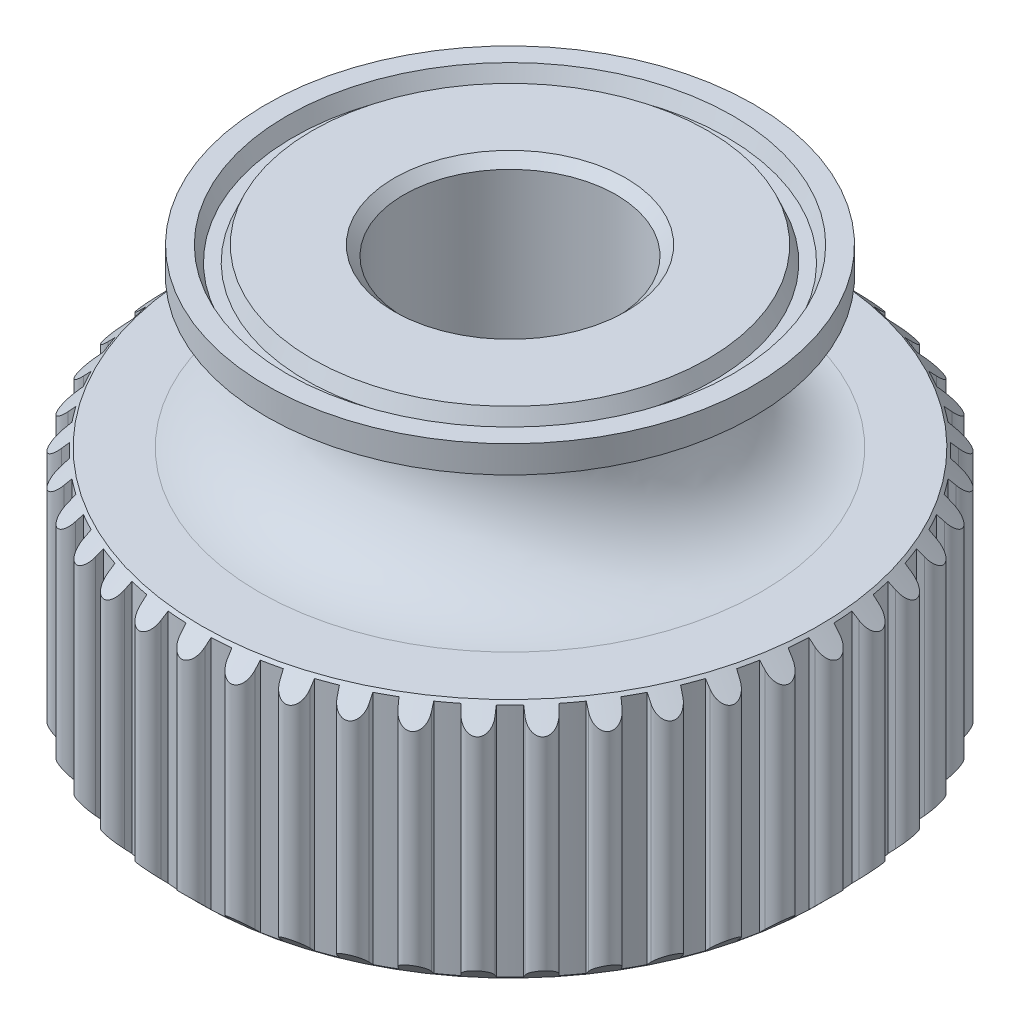
from build123d import *

# Parameters (mm, degrees)
SKETCH1_R           = 25.3
BOSS_EXTRUDE1_DEPTH = 20
SWEEP1_PITCH        = 5
SKETCH10_R          = 32.3
BOSS_EXTRUDE2_DEPTH = 25
SKETCH12_R          = 27.5
CUT_EXTRUDE2_DEPTH  = 2
CUT_EXTRUDE3_DEPTH  = 1
SKETCH16_R          = 11
CUT_EXTRUDE4_DEPTH  = 53.07283378
FILLET2_R           = 1.143
FILLET3_R           = 10
CHAMFER2_SIZE       = 1
BOSS_EXTRUDE3_DEPTH = 25
CIRPATTERN1_COUNT   = 44


with BuildPart() as part:
    # Sketch1 → Boss-Extrude1 (new body)
    with BuildSketch(Plane(origin=(0, 0, 0), x_dir=(1, 0, 0), z_dir=(0, 1, 0))):
        with Locations(Location((0, 0, 0), (0, 0, 270))):
            Circle(SKETCH1_R)
    extrude(amount=BOSS_EXTRUDE1_DEPTH)

    # Sweep1: the profile of Sketch4 screwed along a right-hand helix of 3.5 turns, 12 arcs to a turn; built about Z, then put on its axis
    sweep1_z = Axis((0, 0, 0), (0, 0, 1))
    sweep1_corners = [(25.3, 0.050300798, -1.599209126), (26, 0.050300798, -1.599209126), (27.6, 0, 0), (26, -0.050300798, 1.599209126), (25.4, -0.050300798, 1.599209126), (24.8, -0.050300798, 1.599209126), (24.8, 0.050300798, -1.599209126)]
    with BuildLine(mode=Mode.PRIVATE) as sweep1_profile:
        Line(sweep1_corners[0], sweep1_corners[1])
        Line(sweep1_corners[3], sweep1_corners[4])
        Line(sweep1_corners[4], sweep1_corners[5])
        Line(sweep1_corners[5], sweep1_corners[6])
        Line(sweep1_corners[6], sweep1_corners[0])
        ThreePointArc((26, 0.050300798, -1.599209126), (27.13137085, 0.035568035, -1.130811618), (27.6, 0, 0))
        ThreePointArc((27.6, 0, 0), (27.13137085, -0.035568035, 1.130811618), (26, -0.050300798, 1.599209126))
    sweep1_cap = Face(sweep1_profile.wire())
    sweep1_arcs = [((26, 0.050300798, -1.599209126), (27.6, 0.050300798, -1.599209126), (27.6, 0, 0), (1, 0.7071067811865476, 1)), ((27.6, 0, 0), (27.6, -0.050300798, 1.599209126), (26, -0.050300798, 1.599209126), (1, 0.7071067811865476, 1))]  # start, shoulder, end, weights
    sweep1_turn_angles = [0, 15, 30, 45, 60, 75, 90, 105, 120, 135, 150, 165, 180, 195, 210, 225, 240, 255, 270, 285, 300, 315, 330, 345, 360]
    sweep1_turn_weights = [1, 0.9659258262890683, 1, 0.9659258262890683, 1, 0.9659258262890683, 1, 0.9659258262890683, 1, 0.9659258262890683, 1, 0.9659258262890683, 1, 0.9659258262890683, 1, 0.9659258262890683, 1, 0.9659258262890683, 1, 0.9659258262890683, 1, 0.9659258262890683, 1, 0.9659258262890683, 1]
    sweep1_turn_rails = [Edge.make_bspline([Vector(p[0], p[1], 0).rotate(sweep1_z, sweep1_turn_angles[k]) / sweep1_turn_weights[k] + Vector(0, 0, p[2] + SWEEP1_PITCH * sweep1_turn_angles[k] / 360) for k in range(25)], [0, 0, 0, 1, 1, 2, 2, 3, 3, 4, 4, 5, 5, 6, 6, 7, 7, 8, 8, 9, 9, 10, 10, 11, 11, 12, 12, 12], 2, sweep1_turn_weights) for p in sweep1_corners]
    sweep1_turn_sides = [*[Face.make_surface_from_curves(sweep1_turn_rails[p[0]], sweep1_turn_rails[p[1]]) for p in [(0, 1), (3, 4), (4, 5), (5, 6), (6, 0)]], *[Face.make_bezier_surface([[Vector(p[j][0], p[j][1], 0).rotate(sweep1_z, sweep1_turn_angles[2 * i + k]) / sweep1_turn_weights[2 * i + k] + Vector(0, 0, p[j][2] + SWEEP1_PITCH * sweep1_turn_angles[2 * i + k] / 360) for k in range(3)] for j in range(3)], [[p[3][j] * sweep1_turn_weights[2 * i + k] for k in range(3)] for j in range(3)]) for p in sweep1_arcs for i in range(12)]]
    sweep1_last_angles = [1080, 1095, 1110, 1125, 1140, 1155, 1170, 1185, 1200, 1215, 1230, 1245, 1260]
    sweep1_last_weights = [1, 0.9659258262890683, 1, 0.9659258262890683, 1, 0.9659258262890683, 1, 0.9659258262890683, 1, 0.9659258262890683, 1, 0.9659258262890621, 1]
    sweep1_last_rails = [Edge.make_bspline([Vector(p[0], p[1], 0).rotate(sweep1_z, sweep1_last_angles[k]) / sweep1_last_weights[k] + Vector(0, 0, p[2] + SWEEP1_PITCH * sweep1_last_angles[k] / 360) for k in range(13)], [0, 0, 0, 1, 1, 2, 2, 3, 3, 4, 4, 5, 5, 6, 6, 6], 2, sweep1_last_weights) for p in sweep1_corners]
    sweep1_last_sides = [*[Face.make_surface_from_curves(sweep1_last_rails[p[0]], sweep1_last_rails[p[1]]) for p in [(0, 1), (3, 4), (4, 5), (5, 6), (6, 0)]], *[Face.make_bezier_surface([[Vector(p[j][0], p[j][1], 0).rotate(sweep1_z, sweep1_last_angles[2 * i + k]) / sweep1_last_weights[2 * i + k] + Vector(0, 0, p[j][2] + SWEEP1_PITCH * sweep1_last_angles[2 * i + k] / 360) for k in range(3)] for j in range(3)], [[p[3][j] * sweep1_last_weights[2 * i + k] for k in range(3)] for j in range(3)]) for p in sweep1_arcs for i in range(6)]]
    sweep1 = Plane(origin=(0, 14.5, 0), x_dir=(1, 0, 0), z_dir=(0, -1, 0)) * Solid(Shell([*[p.moved(Location((0, 0, SWEEP1_PITCH * i))) for i in range(3) for p in sweep1_turn_sides], *sweep1_last_sides, sweep1_cap, sweep1_cap.rotate(sweep1_z, 1260).moved(Location((0, 0, SWEEP1_PITCH * 1260 / 360)))]))
    add(sweep1)

    # Sweep3: sweep along a path in Sketch7
    with BuildLine(Plane(origin=(0, 14.5, 0), x_dir=(1, 0, 0), z_dir=(0, 1, 0))) as sweep3_path:
        Line((25.3, 0), (25.3, 0.1))
        ThreePointArc((25.3, 0.1), (24.395629449, 1.864809406), (22.434897906, 2.161407031))
    # Sketch4<2> → Sweep3 (sweep)
    with BuildSketch(Plane(origin=(25.3, 14.5, 0), x_dir=(1, 0, 0), z_dir=(2.889313145858263e-15, -0.031437998702154954, 0.9995057039545114))):
        with BuildLine():
            Line((0, 1.6), (0.7, 1.6))
            ThreePointArc((0.7, 1.6), (2.3, 0), (0.7, -1.6))
            Line((0.7, -1.6), (0.1, -1.6))
            Line((0.1, -1.6), (-0.5, -1.6))
            Line((-0.5, -1.6), (-0.5, 1.6))
            Line((-0.5, 1.6), (0, 1.6))
        make_face()
    sweep(path=sweep3_path.line)


with BuildPart() as body_2:
    # Sketch10 → Boss-Extrude2 (new body)
    with BuildSketch(Plane(origin=(0, 0, 0), x_dir=(1, 0, 0), z_dir=(0, 1, 0))):
        with Locations(Location((0, 0, 0), (0, 0, 270))):
            Circle(SKETCH10_R)
    extrude(amount=BOSS_EXTRUDE2_DEPTH)

    # Combine1: cut part
    add(part.part, mode=Mode.SUBTRACT)

    # Sketch12 → Cut-Extrude2 (cut)
    with BuildSketch(Plane.XZ):
        Circle(SKETCH12_R)
    extrude(amount=-CUT_EXTRUDE2_DEPTH, mode=Mode.SUBTRACT)

    # Sketch13 → Cut-Extrude3 (cut)
    with BuildSketch(Plane.XZ.offset(-2)):
        Polygon((11.06631756, 23.527412646), (12.587410152, 21.946459981), (8.011564195, 20.798163032), (5.806386308, 24.049147386), align=None)
    extrude(amount=-CUT_EXTRUDE3_DEPTH, mode=Mode.SUBTRACT)

    # Sketch15 → Revolve1 (revolve)
    with BuildSketch(Plane.XY, mode=Mode.PRIVATE) as revolve1_sk:
        Polygon((-16, 25), (-16, 37), (-25.25, 40.366724667), (-25.25, 43.173424667), (-23.137062941, 43.173424667), (-22.4686, 41.598624667), (-21.1686, 41.598624667), (-20.500137059, 43.173424667), (-11, 43.173424667), (-11, 25), align=None)
    revolve(revolve1_sk.sketch.rotate(Axis((0, 0, 0), (0, 1, 0)), 270), axis=Axis((0, 0, 0), (0, 1, 0)))

    # Sketch16 → Cut-Extrude4 (cut, through all)
    with BuildSketch(Plane(origin=(0, 25, 0), x_dir=(1, 0, 0), z_dir=(0, 1, 0))):
        with Locations(Location((0, 0, 0), (0, 0, 90))):
            Circle(SKETCH16_R)
    extrude(amount=-CUT_EXTRUDE4_DEPTH, mode=Mode.SUBTRACT)

    # Fillet2
    fillet2_edges = [body_2.edges().sort_by_distance(p)[0] for p in [
        (0, 37, 16),
    ]]
    fillet(fillet2_edges, radius=FILLET2_R)

    # Fillet3
    fillet3_edges = [body_2.edges().sort_by_distance(p)[0] for p in [
        (0, 25, 16),
    ]]
    fillet(fillet3_edges, radius=FILLET3_R)

    # Chamfer2
    chamfer2_edges = [body_2.edges().sort_by_distance(p)[0] for p in [
        (0, 43.173424667, 11),
        (0, 20, 11),
    ]]
    chamfer(chamfer2_edges, length=CHAMFER2_SIZE)

    # Sketch17 → Boss-Extrude3 (add)
    with BuildSketch(Plane(origin=(0, 0, 0), x_dir=(1, 0, 0), z_dir=(0, 1, 0))):
        with BuildLine():
            Line((1.302493198, 32.273727883), (1.25, 32.873727883))
            ThreePointArc((1.25, 32.873727883), (0, 34.019141851), (-1.25, 32.873727883))
            Line((-1.25, 32.873727883), (-1.302493198, 32.273727883))
            ThreePointArc((-1.302493198, 32.273727883), (0, 32.3), (1.302493198, 32.273727883))
        make_face()
    boss_extrude3 = extrude(amount=BOSS_EXTRUDE3_DEPTH)

    # CirPattern1: Boss-Extrude3 ×44 about axis
    cirpattern1_axis = Axis((0, 0, 0), (0, 1, 0))
    for i in range(1, CIRPATTERN1_COUNT):
        add(boss_extrude3.rotate(cirpattern1_axis, i * 360 / CIRPATTERN1_COUNT))

    # Sketch18 → Cut-Revolve1 (revolve, cut)
    with BuildSketch(Plane(origin=(0, 0, 0), x_dir=(0, 0, -1), z_dir=(1, 0, 0)), mode=Mode.PRIVATE) as cut_revolve1_sk:
        Polygon((-34.019141851, 23), (-32.019141851, 25), (-34.019141851, 25), align=None)
    cut_revolve1 = revolve(cut_revolve1_sk.sketch.rotate(Axis((0, 45.444413488, 0), (0, -1, 0)), 205.193413303), axis=Axis((0, 45.444413488, 0), (0, -1, 0)), mode=Mode.SUBTRACT)

    # Mirror1: Cut-Revolve1 across plane
    add(cut_revolve1.mirror(Plane.ZX.offset(12.5)), mode=Mode.SUBTRACT)


solid = body_2.part
